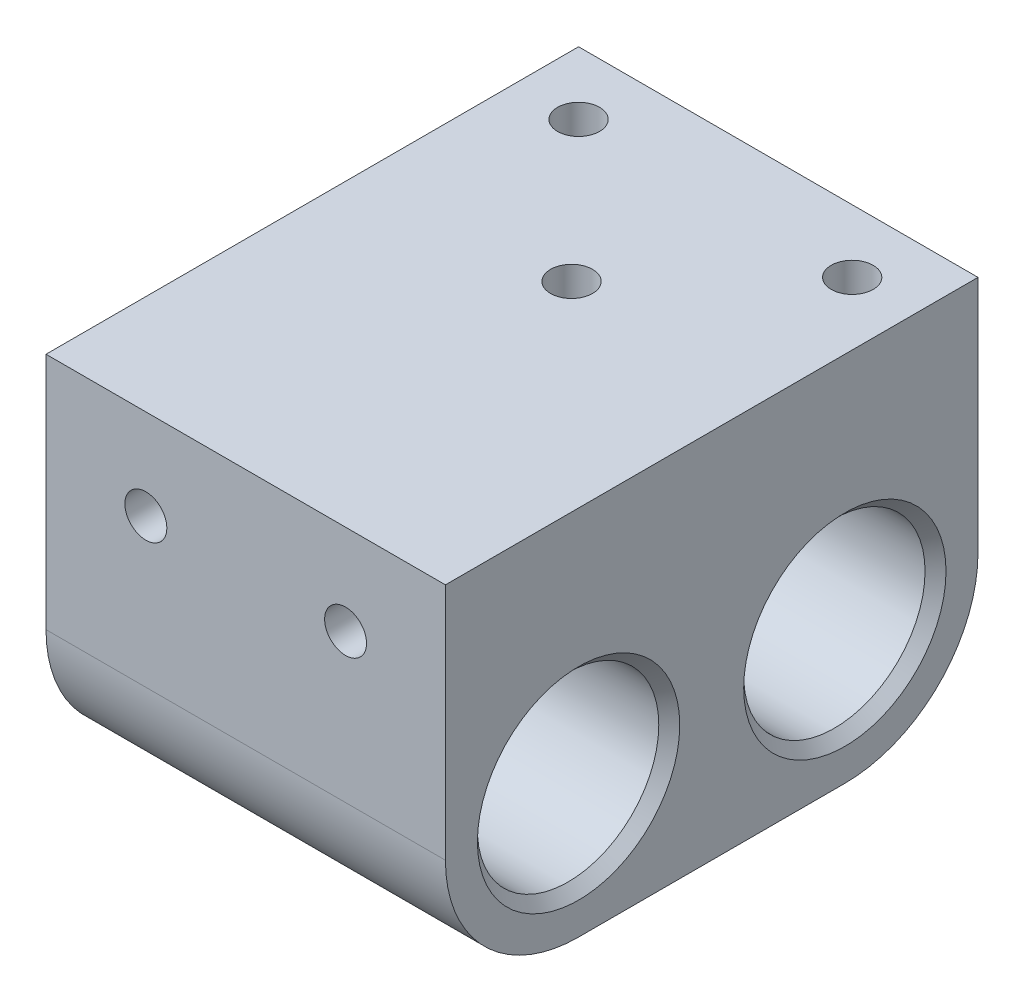
from build123d import *

# Parameters (mm, degrees)
SKETCH1_R           = 8.65
BOSS_EXTRUDE2_DEPTH = 38.1
CUT_EXTRUDE5_REACH  = 74.725
SKETCH6_R           = 2
BOSS_EXTRUDE3_REACH = 74.725
SKETCH10_R          = 2
CUT_EXTRUDE6_DEPTH  = 8
SKETCH11_R          = 2
CUT_EXTRUDE7_DEPTH  = 8
CHAMFER1_SIZE       = 1


with BuildPart() as part:
    # Sketch1 → Boss-Extrude2 (new body)
    with BuildSketch(Plane(origin=(0, 0, 0), x_dir=(0, 0, -1), z_dir=(1, 0, 0))):
        with BuildLine():
            Line((50.8, 22.75), (0, 22.75))
            Line((0, 22.75), (0, 0))
            ThreePointArc((0, 0), (12.7, -12.7), (25.4, 0))
            ThreePointArc((25.4, 0), (38.1, -12.7), (50.8, 0))
            Line((50.8, 0), (50.8, 22.75))
        make_face()
        with Locations((38.1, 0)):
            Circle(SKETCH1_R, mode=Mode.SUBTRACT)
        with Locations((12.7, 0)):
            Circle(SKETCH1_R, mode=Mode.SUBTRACT)
    extrude(amount=BOSS_EXTRUDE2_DEPTH)

    # Sketch6 → Cut-Extrude5 (cut, up to next)
    with BuildSketch(Plane(origin=(0, -12.7, 0), x_dir=(-1, 0, 0), z_dir=(0, -1, 0)), mode=Mode.PRIVATE) as cut_extrude5_sk1:
        with Locations((-19.05, 38.1)):
            Circle(SKETCH6_R)
    cut_extrude5_tool1 = extrude(cut_extrude5_sk1.sketch, amount=-CUT_EXTRUDE5_REACH, mode=Mode.PRIVATE) & part.part
    # Sketch6 → Cut-Extrude5 (cut, up to next)
    with BuildSketch(Plane(origin=(0, -12.7, 0), x_dir=(-1, 0, 0), z_dir=(0, -1, 0)), mode=Mode.PRIVATE) as cut_extrude5_sk2:
        with Locations((-19.05, 12.7)):
            Circle(SKETCH6_R)
    cut_extrude5_tool2 = extrude(cut_extrude5_sk2.sketch, amount=-CUT_EXTRUDE5_REACH, mode=Mode.PRIVATE) & part.part
    add(cut_extrude5_tool1.solids().sort_by_distance((19.05, -12.7, -38.1))[0], mode=Mode.SUBTRACT)
    add(cut_extrude5_tool2.solids().sort_by_distance((19.05, -12.7, -12.7))[0], mode=Mode.SUBTRACT)

    # Sketch6<3> → Boss-Extrude3 (add, up to next)
    with BuildSketch(Plane(origin=(0, -12.7, 0), x_dir=(-1, 0, 0), z_dir=(0, -1, 0)), mode=Mode.PRIVATE) as boss_extrude3_sk1:
        with BuildLine():
            Line((0, 38.1), (-17.05, 38.1))
            ThreePointArc((-17.05, 38.1), (-19.05, 36.1), (-21.05, 38.1))
            Line((-21.05, 38.1), (-38.1, 38.1))
            Line((-38.1, 38.1), (-38.1, 12.7))
            Line((-38.1, 12.7), (-21.05, 12.7))
            ThreePointArc((-21.05, 12.7), (-19.05, 14.7), (-17.05, 12.7))
            Line((-17.05, 12.7), (0, 12.7))
            Line((0, 12.7), (0, 38.1))
        make_face()
    boss_extrude3_tool1 = extrude(boss_extrude3_sk1.sketch, amount=-BOSS_EXTRUDE3_REACH, mode=Mode.PRIVATE) - part.part
    add(boss_extrude3_tool1.solids().sort_by_distance((19.05, -12.7, -25.4))[0])

    # Sketch10 → Cut-Extrude6 (cut)
    with BuildSketch(Plane.XY):
        with Locations((9.525, 14.153125)):
            Circle(SKETCH10_R)
        with Locations((28.575, 14.153125)):
            Circle(SKETCH10_R)
    extrude(amount=-CUT_EXTRUDE6_DEPTH, mode=Mode.SUBTRACT)

    # Sketch11 → Cut-Extrude7 (cut)
    with BuildSketch(Plane(origin=(0, 22.75, 0), x_dir=(1, 0, 0), z_dir=(0, 1, 0))):
        with Locations((19.05, 31.08)):
            Circle(SKETCH11_R)
        with Locations((6, 44.8)):
            Circle(SKETCH11_R)
        with Locations((32.1, 44.8)):
            Circle(SKETCH11_R)
    extrude(amount=-CUT_EXTRUDE7_DEPTH, mode=Mode.SUBTRACT)

    # Chamfer1
    chamfer1_edges = [part.edges().sort_by_distance(p)[0] for p in [
        (38.1, 0, -4.05),
        (38.1, 0, -29.45),
        (0, 0, -4.05),
        (0, 0, -29.45),
    ]]
    chamfer(chamfer1_edges, length=CHAMFER1_SIZE)


solid = part.part
